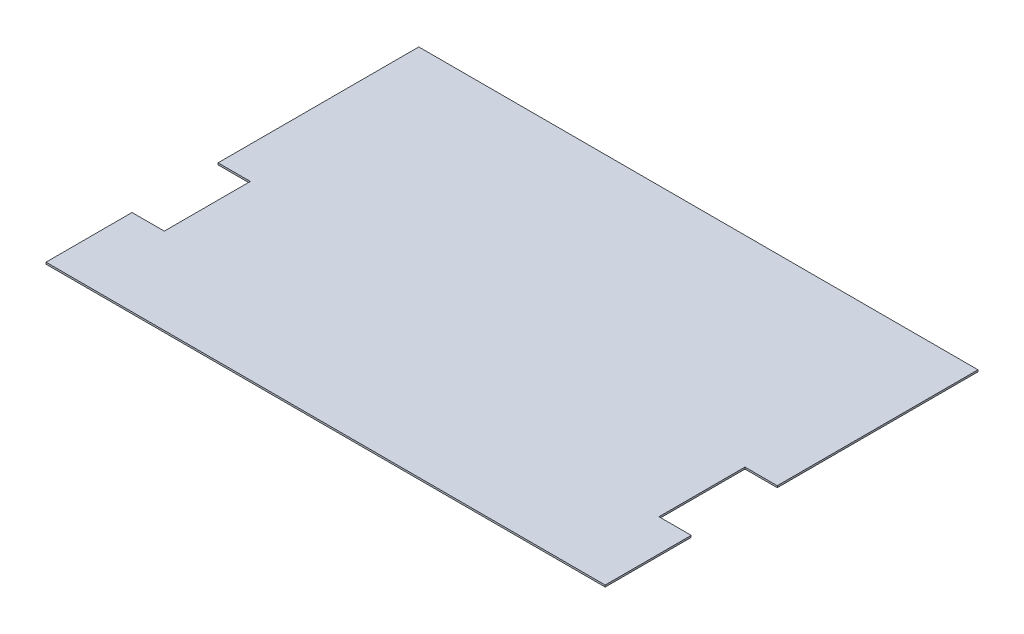
from build123d import *

# Parameters (mm, degrees)
BASE_FLANGE1_DEPTH = 1.5875


# Sheet-metal steps are written as plain solids
with BuildPart() as part:
    # Sketch1 → Base-Flange1 (new body)
    with BuildSketch(Plane(origin=(0, 0, 0), x_dir=(1, 0, 0), z_dir=(0, 1, 0))):
        Polygon((219.075, -88.9), (247.65, -88.9), (247.65, 88.9), (-247.65, 88.9), (-247.65, -88.9), (-219.075, -88.9), (-219.075, -165.1), (-247.65, -165.1), (-247.65, -241.3), (247.65, -241.3), (247.65, -165.1), (219.075, -165.1), align=None)
    extrude(amount=-BASE_FLANGE1_DEPTH)


solid = part.part
